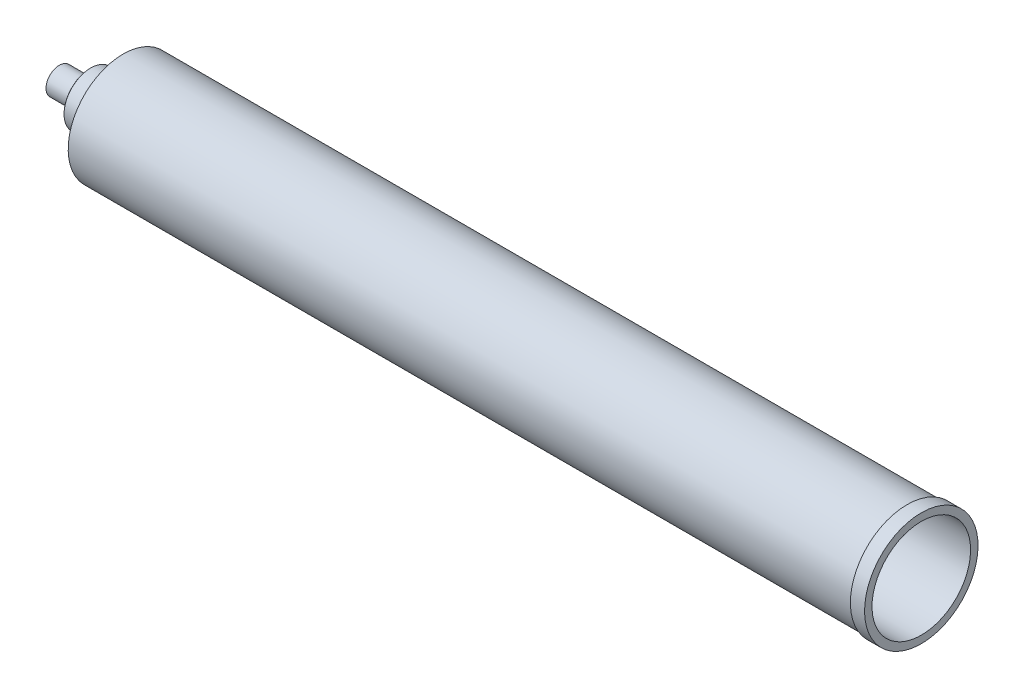
from build123d import *

# Parameters (mm, degrees)
SKETCH19_R         = 4
CUT_EXTRUDE3_DEPTH = 25.4


with BuildPart() as part:
    # Sketch1 → Revolve1 (revolve)
    with BuildSketch(Plane.XY):
        with BuildLine():
            Line((0, 0), (0, 11.938))
            Line((0, 11.938), (24.765, 11.938))
            ThreePointArc((24.765, 11.938), (26.561051224, 12.681948776), (27.305, 14.478))
            Line((27.305, 14.478), (27.305, 22.933028409))
            Line((27.305, 22.933028409), (28.104406531, 23.876))
            Line((28.104406531, 23.876), (57.15, 23.876))
            Line((57.15, 23.876), (57.15, 49.2125))
            Line((57.15, 49.2125), (759.206, 49.2125))
            Line((759.206, 49.2125), (759.206, 50.8))
            Line((759.206, 50.8), (771.906, 50.8))
            Line((771.906, 50.8), (771.906, 49.2125))
            Line((771.906, 49.2125), (771.906, 44.1325))
            Line((771.906, 44.1325), (62.23, 44.1325))
            Line((62.23, 44.1325), (62.23, 0))
            Line((62.23, 0), (0, 0))
        make_face()
    revolve(axis=Axis((62.23, 0, 0), (-1, 0, 0)))

    # Sketch16 → Cut-Revolve1 (revolve, cut)
    with BuildSketch(Plane(origin=(0, 0, 0), x_dir=(1, 0, 0), z_dir=(0, 1, 0))):
        Polygon((0, 0), (0, 8.35025), (1.905, 6.556375), (1.905, 0), align=None)
    revolve(axis=Axis((1.905, 0, 0), (-1, 0, 0)), mode=Mode.SUBTRACT)

    # Sketch19 → Cut-Extrude3 (cut)
    with BuildSketch(Plane.ZY.offset(-1.905)):
        Circle(SKETCH19_R)
    extrude(amount=-CUT_EXTRUDE3_DEPTH, mode=Mode.SUBTRACT)

    # Sketch32 → Cut-Revolve6 (revolve, cut)
    with BuildSketch(Plane(origin=(0, 0, 0), x_dir=(1, 0, 0), z_dir=(0, 1, 0))):
        Polygon((27.305, 0), (28.575, 0), (27.305, 6.351059428), align=None)
    revolve(axis=Axis((27.305, 0, 0), (1, 0, 0)), mode=Mode.SUBTRACT)


solid = part.part
